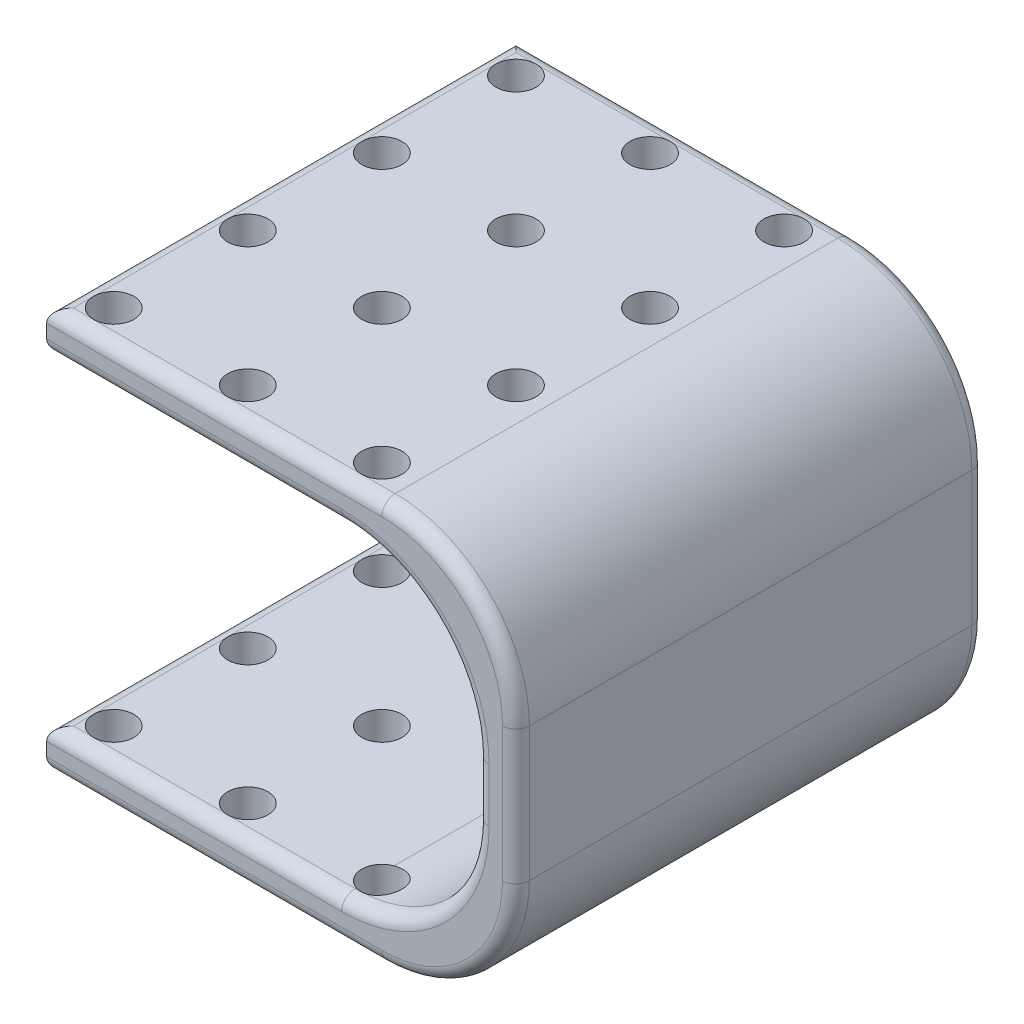
from build123d import *

# Parameters (mm, degrees)
BOSS_EXTRU_1_DEPTH      = 35
ESQUISSE2_R             = 1.5
ENL_V_MAT_EXTRU_1_DEPTH = 73
CONG_3_R                = 1


with BuildPart() as part:
    # Esquisse1 → Boss.-Extru.1 (new body)
    with BuildSketch(Plane.XY):
        with BuildLine():
            Line((0, 0), (25, 0))
            ThreePointArc((25, 0), (32.071067812, 2.928932188), (35, 10))
            Line((35, 10), (35, 20))
            ThreePointArc((35, 20), (32.071067812, 27.071067812), (25, 30))
            Line((25, 30), (0, 30))
            Line((0, 30), (0, 27))
            Line((0, 27), (22, 27))
            ThreePointArc((22, 27), (29.071067812, 24.071067812), (32, 17))
            Line((32, 17), (32, 13))
            ThreePointArc((32, 13), (29.071067812, 5.928932188), (22, 3))
            Line((22, 3), (0, 3))
            Line((0, 3), (0, 0))
        make_face()
    extrude(amount=BOSS_EXTRU_1_DEPTH)

    # Esquisse2 → Enlèv. mat.-Extru.1 (cut)
    with BuildSketch(Plane(origin=(0, 30, 0), x_dir=(1, 0, 0), z_dir=(0, 1, 0))):
        with Locations(Location((2.5, -2.5, 0), (0, 0, 270))):
            Circle(ESQUISSE2_R)
        with Locations(Location((12.5, -2.5, 0), (0, 0, 270))):
            Circle(ESQUISSE2_R)
        with Locations(Location((22.5, -2.5, 0), (0, 0, 109.471220634))):
            Circle(ESQUISSE2_R)
        with Locations(Location((12.5, -12.5, 0), (0, 0, 270))):
            Circle(ESQUISSE2_R)
        with Locations(Location((22.5, -12.5, 0), (0, 0, 109.471220634))):
            Circle(ESQUISSE2_R)
        with Locations(Location((12.5, -22.5, 0), (0, 0, 270))):
            Circle(ESQUISSE2_R)
        with Locations(Location((22.5, -22.5, 0), (0, 0, 109.471220635))):
            Circle(ESQUISSE2_R)
        with Locations(Location((12.5, -32.5, 0), (0, 0, 270))):
            Circle(ESQUISSE2_R)
        with Locations(Location((22.5, -32.5, 0), (0, 0, 109.471220635))):
            Circle(ESQUISSE2_R)
        with Locations(Location((2.5, -12.5, 0), (0, 0, 270))):
            Circle(ESQUISSE2_R)
        with Locations(Location((2.5, -22.5, 0), (0, 0, 270))):
            Circle(ESQUISSE2_R)
        with Locations(Location((2.5, -32.5, 0), (0, 0, 270))):
            Circle(ESQUISSE2_R)
    extrude(amount=-ENL_V_MAT_EXTRU_1_DEPTH, mode=Mode.SUBTRACT)

    # Congé3
    cong_3_edges = [part.edges().sort_by_distance(p)[0] for p in [
        (32.071067812, 2.928932188, 35),
        (11, 3, 0),
        (29.071067812, 5.928932188, 0),
        (32, 15, 0),
        (29.071067812, 24.071067812, 0),
        (11, 27, 0),
        (35, 15, 35),
        (12.5, 30, 0),
        (32.071067812, 27.071067812, 0),
        (35, 15, 0),
        (32.071067812, 2.928932188, 0),
        (12.5, 0, 0),
        (32.071067812, 27.071067812, 35),
        (12.5, 30, 35),
        (0, 3, 17.5),
        (0, 27, 17.5),
        (0, 30, 17.5),
        (0, 0, 17.5),
        (11, 27, 35),
        (29.071067812, 24.071067812, 35),
        (32, 15, 35),
        (29.071067812, 5.928932188, 35),
        (11, 3, 35),
        (12.5, 0, 35),
    ]]
    fillet(cong_3_edges, radius=CONG_3_R - 0.0001)  # a hair under: the kernel refuses the full size


solid = part.part
